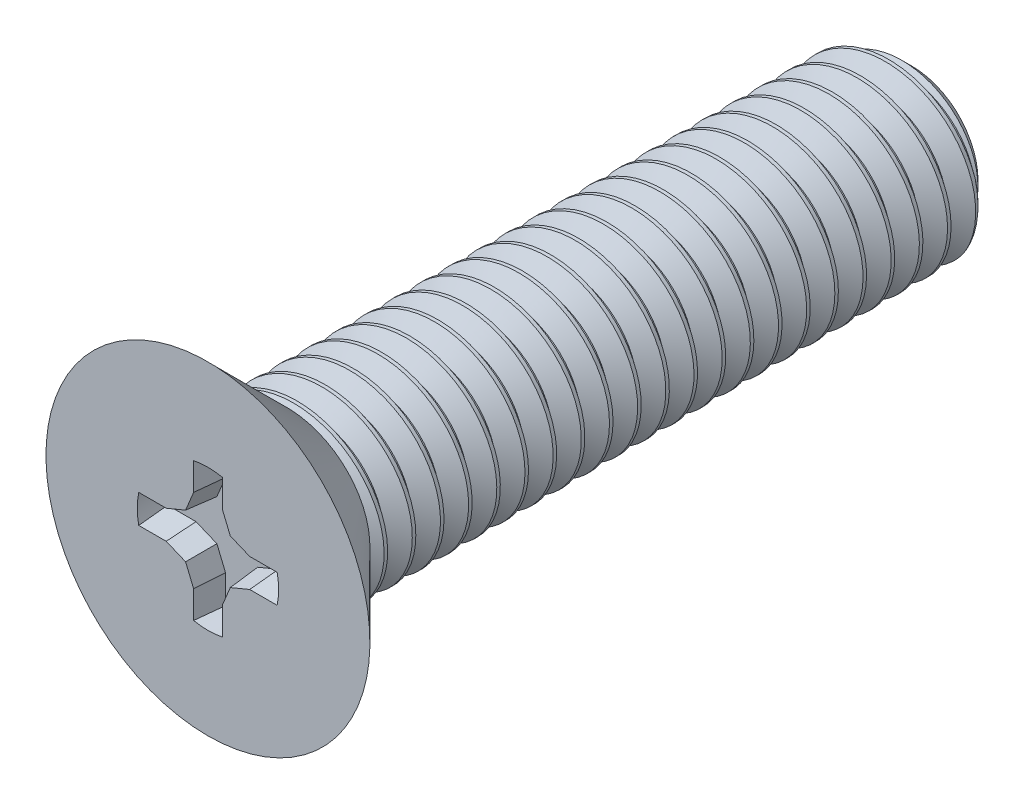
from build123d import *

# Parameters (mm, degrees)
CUT_EXTRUDE1_DEPTH  = 0.833333333
CIRPATTERN1_COUNT   = 4
DRAFT2_ANGLE        = 5
CUT_SWEEP1_PITCH    = 0.8
CUT_SWEEP1_TO       = 17.9
SKETCH8_R           = 2.5
BOSS_EXTRUDE1_DEPTH = 0.4
BOSS_EXTRUDE1_DRAFT = -45


with BuildPart() as part:
    # Sketch3 → Revolve1 (revolve)
    with BuildSketch(Plane(origin=(0, 0, 0), x_dir=(0, 0, -1), z_dir=(1, 0, 0)), mode=Mode.PRIVATE) as revolve1_sk:
        Polygon((-2.5, 0), (-2.5, 4.6), (-0.4, 2.5), (-0.4, 0), align=None)
    revolve(revolve1_sk.sketch.rotate(Axis((0, 0, 2.5), (0, 0, -1)), 180), axis=Axis((0, 0, 2.5), (0, 0, -1)))

    # Sketch5 → Revolve2 (revolve)
    with BuildSketch(Plane(origin=(0, 0, 0), x_dir=(0, 0, -1), z_dir=(1, 0, 0))):
        Polygon((17.5, 0), (-0.4, 0), (-0.4, 2.5), (16.868, 2.5), (17.5, 1.868), align=None)
    revolve(axis=Axis((0, 0, -17.5), (0, 0, 1)))

    # Sketch4 → Cut-Extrude1 (cut)
    with BuildSketch(Plane.XY.offset(2.5)):
        with BuildLine():
            Line((0, 0), (2.0066, 0))
            ThreePointArc((2.0066, 0), (1.996176592, 0.204261047), (1.965014656, 0.4064))
            Line((1.965014656, 0.4064), (1.185707328, 0.4064))
            Line((1.185707328, 0.4064), (0.634653832, 0.634653832))
            Line((0.634653832, 0.634653832), (0.4064, 1.185707328))
            Line((0.4064, 1.185707328), (0.4064, 1.965014656))
            ThreePointArc((0.4064, 1.965014656), (0.204261047, 1.996176592), (0, 2.0066))
            Line((0, 2.0066), (0, 0))
        make_face()
    cut_extrude1 = extrude(amount=-CUT_EXTRUDE1_DEPTH, mode=Mode.SUBTRACT)

    # CirPattern1: Cut-Extrude1 ×4 about axis
    cirpattern1_axis = Axis((0, 0, 0), (0, 0, 1))
    for i in range(1, CIRPATTERN1_COUNT):
        add(cut_extrude1.rotate(cirpattern1_axis, i * 360 / CIRPATTERN1_COUNT), mode=Mode.SUBTRACT)

    # Draft2
    draft2_faces = [part.faces().sort_by_distance(p)[0] for p in [
        (-1.575360992, 0.4064, 2.083333333),
        (-0.91018058, 0.520526916, 2.083333333),
        (-0.520526916, 0.91018058, 2.083333333),
        (-0.4064, 1.575360992, 2.083333333),
        (0.4064, 1.575360992, 2.083333333),
        (0.520526916, 0.91018058, 2.083333333),
        (0.91018058, 0.520526916, 2.083333333),
        (1.575360992, 0.4064, 2.083333333),
        (1.575360992, -0.4064, 2.083333333),
        (0.91018058, -0.520526916, 2.083333333),
        (0.520526916, -0.91018058, 2.083333333),
        (0.4064, -1.575360992, 2.083333333),
        (-0.4064, -1.575360992, 2.083333333),
        (-0.520526916, -0.91018058, 2.083333333),
        (-0.91018058, -0.520526916, 2.083333333),
        (-1.575360992, -0.4064, 2.083333333),
    ]]
    draft(draft2_faces, Plane(origin=(0, 0, 2.5), x_dir=(0, 1, 0), z_dir=(0, 0, 1)), DRAFT2_ANGLE)


with BuildPart() as body_2:
    # Split1: the piece on the far side of the plane
    add(part.part)
    split(bisect_by=Plane(origin=(0, 0, 0.4), x_dir=(0, -1, 0), z_dir=(0, 0, -1)), keep=Keep.BOTTOM)


with BuildPart() as part_1:
    add(part.part)

    # Split1
    split(bisect_by=Plane(origin=(0, 0, 0.4), x_dir=(0, -1, 0), z_dir=(0, 0, -1)), keep=Keep.TOP)

    # Cut-Sweep1: arcs per turn and ends read off the stored shape
    # Cut-Sweep1: the profile of Sketch7 screwed along a right-hand helix through 25 turns, 8 arcs to a turn; built about Z, then put on its axis
    cut_sweep1_z = Axis((0, 0, 0), (0, 0, 1))
    cut_sweep1_corners = [(1.980384758, 0, -0.4), (1.980384758, 0, -0.3), (2.54330127, 0, 0.025), (2.54330127, 0, -0.725)]
    with BuildLine(mode=Mode.PRIVATE) as cut_sweep1_profile:
        Line(cut_sweep1_corners[0], cut_sweep1_corners[1])
        Line(cut_sweep1_corners[1], cut_sweep1_corners[2])
        Line(cut_sweep1_corners[2], cut_sweep1_corners[3])
        Line(cut_sweep1_corners[3], cut_sweep1_corners[0])
    cut_sweep1_cap = Face(cut_sweep1_profile.wire())
    cut_sweep1_turn_angles = [0, 22.5, 45, 67.5, 90, 112.5, 135, 157.5, 180, 202.5, 225, 247.5, 270, 292.5, 315, 337.5, 360]
    cut_sweep1_turn_weights = [1, 0.9238795325112867, 1, 0.9238795325112867, 1, 0.9238795325112867, 1, 0.9238795325112867, 1, 0.9238795325112867, 1, 0.9238795325112867, 1, 0.9238795325112867, 1, 0.9238795325112867, 1]
    cut_sweep1_turn_rails = [Edge.make_bspline([Vector(p[0], p[1], 0).rotate(cut_sweep1_z, cut_sweep1_turn_angles[k]) / cut_sweep1_turn_weights[k] + Vector(0, 0, p[2] + CUT_SWEEP1_PITCH * cut_sweep1_turn_angles[k] / 360) for k in range(17)], [0, 0, 0, 1, 1, 2, 2, 3, 3, 4, 4, 5, 5, 6, 6, 7, 7, 8, 8, 8], 2, cut_sweep1_turn_weights) for p in cut_sweep1_corners]
    cut_sweep1_turn_sides = [Face.make_surface_from_curves(cut_sweep1_turn_rails[p[0]], cut_sweep1_turn_rails[p[1]]) for p in [(0, 1), (1, 2), (2, 3), (3, 0)]]
    cut_sweep1 = Plane(origin=(0, 0, -17.5), x_dir=(0, 1, 0), z_dir=(0, 0, 1)) * split(Solid(Shell([*[p.moved(Location((0, 0, CUT_SWEEP1_PITCH * i))) for i in range(25) for p in cut_sweep1_turn_sides], cut_sweep1_cap, cut_sweep1_cap.rotate(cut_sweep1_z, 9000).moved(Location((0, 0, CUT_SWEEP1_PITCH * 9000 / 360)))])), bisect_by=Plane.XY.offset(CUT_SWEEP1_TO), keep=Keep.BOTTOM, mode=Mode.PRIVATE)
    add(cut_sweep1, mode=Mode.SUBTRACT)


with BuildPart() as body_2_1:
    add(body_2.part)

    # Combine1: union part
    add(part_1.part)


with BuildPart() as boss_extrude1_tool:
    # Sketch8 → Boss-Extrude1 (with draft: the straight prism first)
    with BuildSketch(Plane.XY.offset(0.4)):
        Circle(SKETCH8_R)
    extrude(amount=-BOSS_EXTRUDE1_DEPTH)
    # Boss-Extrude1: the draft: its side faces are tilted about the plane it starts from
    boss_extrude1_sides = [boss_extrude1_tool.faces().sort_by_distance(p)[0] for p in [
        (-2.5, 0, 0.2),
    ]]
    draft(boss_extrude1_sides, Plane.XY.offset(0.4), BOSS_EXTRUDE1_DRAFT)


with BuildPart() as body_2_2:
    add(body_2_1.part)

    # Boss-Extrude1: add boss_extrude1_tool
    add(boss_extrude1_tool.part)


solid = body_2_2.part
